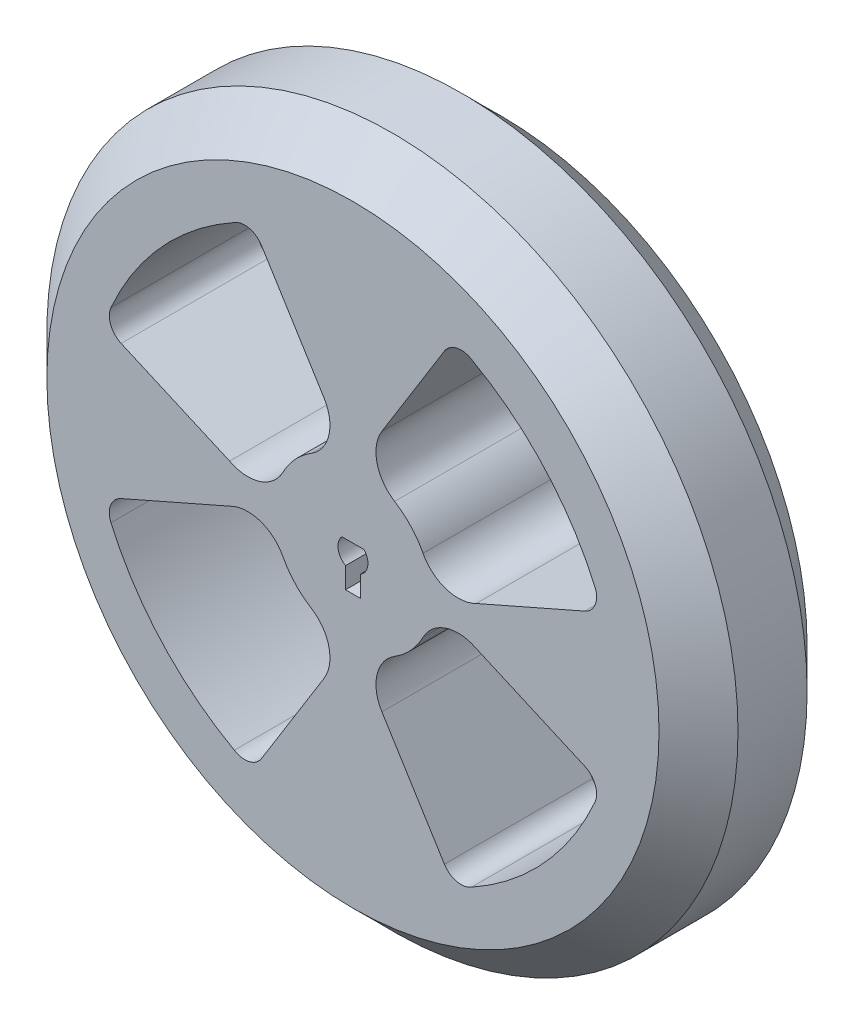
from build123d import *

# Parameters (mm, degrees)
SKETCH1_R           = 35
BOSS_EXTRUDE1_DEPTH = 15
CUT_EXTRUDE1_DEPTH  = 15
CUT_EXTRUDE3_DEPTH  = 15
CHAMFER1_SIZE       = 4
CHAMFER2_SIZE       = 4


with BuildPart() as part:
    # Sketch1 → Boss-Extrude1 (new body)
    with BuildSketch(Plane.XY):
        Circle(SKETCH1_R)
    extrude(amount=BOSS_EXTRUDE1_DEPTH)

    # Sketch3 → Cut-Extrude1 (cut)
    with BuildSketch(Plane.XY.offset(15)):
        with BuildLine():
            Line((-2.931541094, 12.304717259), (-9.261343256, 22.499500463))
            ThreePointArc((-9.261343256, 22.499500463), (-10.504981406, 23.391974498), (-12.015440817, 23.14366397))
            ThreePointArc((-12.015440817, 23.14366397), (-19.385684382, 17.316426669), (-24.507199422, 9.439417816))
            ThreePointArc((-24.507199422, 9.439417816), (-24.539596271, 7.909026953), (-23.480354546, 6.803969164))
            Line((-23.480354546, 6.803969164), (-12.49347396, 1.978157834))
            ThreePointArc((-12.49347396, 1.978157834), (-9.44334271, 1.714942412), (-7.100452809, 3.685589492))
            ThreePointArc((-7.100452809, 3.685589492), (-5.86999931, 5.43535722), (-4.219868108, 6.796522136))
            ThreePointArc((-4.219868108, 6.796522136), (-2.434920039, 9.283798436), (-2.931541094, 12.304717259))
        make_face()
        with BuildLine():
            Line((-2.931541094, -12.304717259), (-9.261343256, -22.499500463))
            ThreePointArc((-9.261343256, -22.499500463), (-10.504981406, -23.391974498), (-12.015440817, -23.14366397))
            ThreePointArc((-12.015440817, -23.14366397), (-19.385684382, -17.316426669), (-24.507199422, -9.439417816))
            ThreePointArc((-24.507199422, -9.439417816), (-24.539596271, -7.909026953), (-23.480354546, -6.803969164))
            Line((-23.480354546, -6.803969164), (-12.49347396, -1.978157834))
            ThreePointArc((-12.49347396, -1.978157834), (-9.44334271, -1.714942412), (-7.100452809, -3.685589492))
            ThreePointArc((-7.100452809, -3.685589492), (-5.86999931, -5.43535722), (-4.219868108, -6.796522136))
            ThreePointArc((-4.219868108, -6.796522136), (-2.434920039, -9.283798436), (-2.931541094, -12.304717259))
        make_face()
        with BuildLine():
            Line((2.931541094, -12.304717259), (9.261343256, -22.499500463))
            ThreePointArc((9.261343256, -22.499500463), (10.504981406, -23.391974498), (12.015440817, -23.14366397))
            ThreePointArc((12.015440817, -23.14366397), (19.385684382, -17.316426669), (24.507199422, -9.439417816))
            ThreePointArc((24.507199422, -9.439417816), (24.539596271, -7.909026953), (23.480354546, -6.803969164))
            Line((23.480354546, -6.803969164), (12.49347396, -1.978157834))
            ThreePointArc((12.49347396, -1.978157834), (9.44334271, -1.714942412), (7.100452809, -3.685589492))
            ThreePointArc((7.100452809, -3.685589492), (5.86999931, -5.43535722), (4.219868108, -6.796522136))
            ThreePointArc((4.219868108, -6.796522136), (2.434920039, -9.283798436), (2.931541094, -12.304717259))
        make_face()
        with BuildLine():
            Line((2.931541094, 12.304717259), (9.261343256, 22.499500463))
            ThreePointArc((9.261343256, 22.499500463), (10.504981406, 23.391974498), (12.015440817, 23.14366397))
            ThreePointArc((12.015440817, 23.14366397), (19.385684382, 17.316426669), (24.507199422, 9.439417816))
            ThreePointArc((24.507199422, 9.439417816), (24.539596271, 7.909026953), (23.480354546, 6.803969164))
            Line((23.480354546, 6.803969164), (12.49347396, 1.978157834))
            ThreePointArc((12.49347396, 1.978157834), (9.44334271, 1.714942412), (7.100452809, 3.685589492))
            ThreePointArc((7.100452809, 3.685589492), (5.86999931, 5.43535722), (4.219868108, 6.796522136))
            ThreePointArc((4.219868108, 6.796522136), (2.434920039, 9.283798436), (2.931541094, 12.304717259))
        make_face()
    extrude(amount=-CUT_EXTRUDE1_DEPTH, mode=Mode.SUBTRACT)

    # Sketch2 → Cut-Extrude3 (cut)
    with BuildSketch(Plane.XY.offset(15)):
        with BuildLine():
            Line((1.12, 1.025), (-1.12, 1.025))
            ThreePointArc((-1.12, 1.025), (-1.499678888, -0.236618331), (-0.75, -1.320047348))
            Line((-0.75, -1.320047348), (-0.75, -3.441570324))
            Line((-0.75, -3.441570324), (0.75, -3.441570324))
            Line((0.75, -3.441570324), (0.75, -1.320047348))
            ThreePointArc((0.75, -1.320047348), (1.499678888, -0.236618331), (1.12, 1.025))
        make_face()
    extrude(amount=-CUT_EXTRUDE3_DEPTH, mode=Mode.SUBTRACT)

    # Chamfer1
    chamfer1_edges = [part.edges().sort_by_distance(p)[0] for p in [
        (-35, 0, 0),
    ]]
    chamfer(chamfer1_edges, length=CHAMFER1_SIZE)

    # Chamfer2
    chamfer2_edges = [part.edges().sort_by_distance(p)[0] for p in [
        (-35, 0, 15),
    ]]
    chamfer(chamfer2_edges, length=CHAMFER2_SIZE)


solid = part.part
